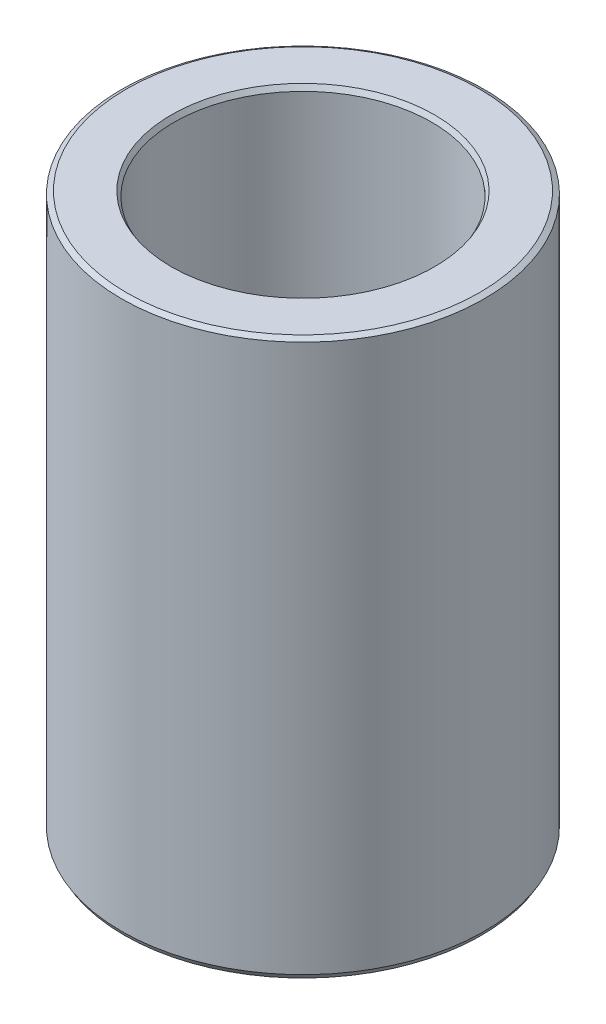
from build123d import *
from OCP.BRepFilletAPI import BRepFilletAPI_MakeChamfer

# Parameters (mm, degrees)
SKETCH1_R           = 22.5
BOSS_EXTRUDE1_DEPTH = 68.912025191
SKETCH2_R           = 15.975662252
CUT_EXTRUDE1_DEPTH  = 76.903670636
CHAMFER1_SIZE       = 0.352884611
CHAMFER1_SIZE2      = 0.611214075


with BuildPart() as part:
    # Sketch1 → Boss-Extrude1 (new body)
    with BuildSketch(Plane(origin=(0, 0, 0), x_dir=(1, 0, 0), z_dir=(0, 1, 0))):
        Circle(SKETCH1_R)
    extrude(amount=BOSS_EXTRUDE1_DEPTH)

    # Sketch2 → Cut-Extrude1 (cut, through all)
    with BuildSketch(Plane(origin=(0, 0, 0), x_dir=(1, 0, 0), z_dir=(0, 1, 0))):
        Circle(SKETCH2_R)
    extrude(amount=CUT_EXTRUDE1_DEPTH, mode=Mode.SUBTRACT)

    # Chamfer1: one chamfer whose edges measure the first distance from different faces: ONE call of the kernel's chamfer builder (chamfer() names one face for all edges)
    chamfer1_edges_1 = [part.edges().sort_by_distance(p)[0] for p in [
        (-15.975662252, 68.912025191, 0),
    ]]
    chamfer1_side_1 = [part.faces().sort_by_distance(p)[0] for p in [
        (-21.863603897, 68.912025191, 0),
    ]]
    chamfer1_edges_2 = [part.edges().sort_by_distance(p)[0] for p in [
        (-15.975662252, 0, 0),
    ]]
    chamfer1_side_2 = [part.faces().sort_by_distance(p)[0] for p in [
        (-15.975662252, 34.456012596, 0),
    ]]
    chamfer1_edges_3 = [part.edges().sort_by_distance(p)[0] for p in [
        (-22.5, 0, 0),
    ]]
    chamfer1_side_3 = [part.faces().sort_by_distance(p)[0] for p in [
        (-21.863603897, 0, 0),
    ]]
    chamfer1_edges_4 = [part.edges().sort_by_distance(p)[0] for p in [
        (-22.5, 68.912025191, 0),
    ]]
    chamfer1_side_4 = [part.faces().sort_by_distance(p)[0] for p in [
        (-22.5, 34.456012596, 0),
    ]]
    chamfer1 = BRepFilletAPI_MakeChamfer(part.part.solid().wrapped)
    for e in chamfer1_edges_1:
        chamfer1.Add(CHAMFER1_SIZE, CHAMFER1_SIZE2, e.wrapped, chamfer1_side_1[0].wrapped)  # the first distance lies on this face
    for e in chamfer1_edges_2:
        chamfer1.Add(CHAMFER1_SIZE, CHAMFER1_SIZE2, e.wrapped, chamfer1_side_2[0].wrapped)  # the first distance lies on this face
    for e in chamfer1_edges_3:
        chamfer1.Add(CHAMFER1_SIZE, CHAMFER1_SIZE2, e.wrapped, chamfer1_side_3[0].wrapped)  # the first distance lies on this face
    for e in chamfer1_edges_4:
        chamfer1.Add(CHAMFER1_SIZE, CHAMFER1_SIZE2, e.wrapped, chamfer1_side_4[0].wrapped)  # the first distance lies on this face
    add(Compound.cast(chamfer1.Shape()), mode=Mode.REPLACE)


solid = part.part
